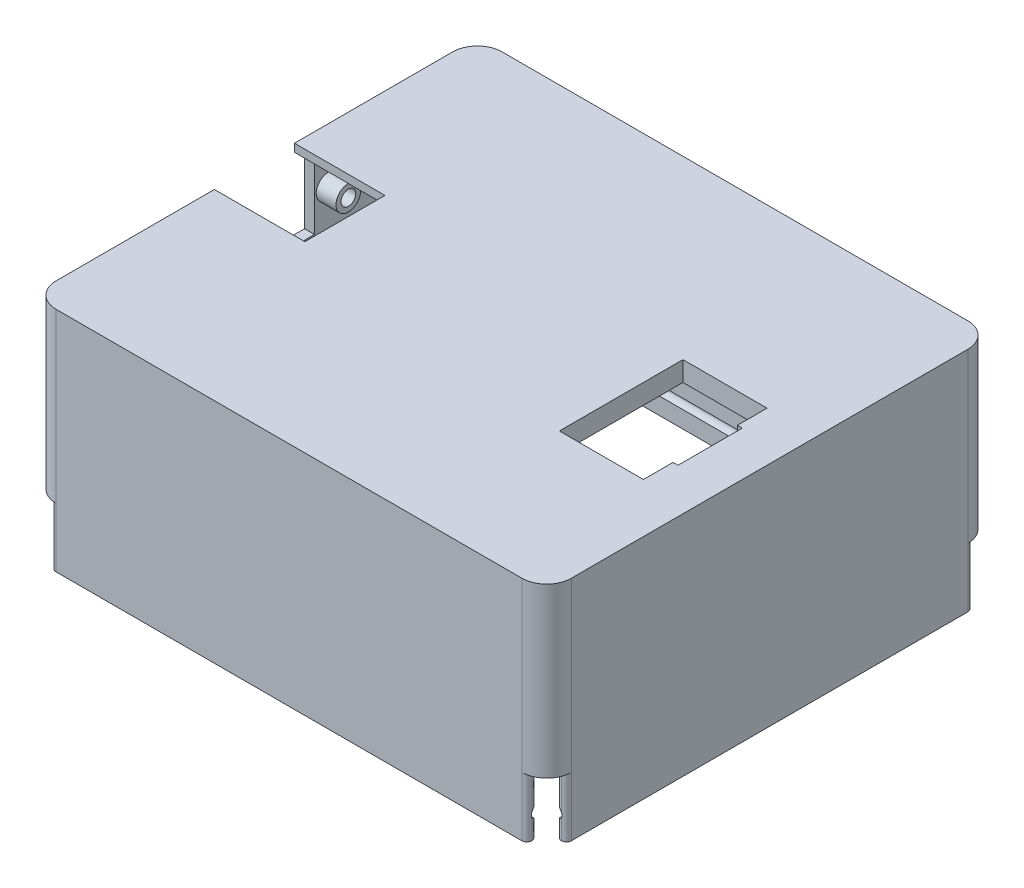
from build123d import *

# Parameters (mm, degrees)
ESQUISSE1_W                  = 104.2
ESQUISSE1_H                  = 90.2
BOSS_EXTRU_1_DEPTH           = 2
ESQUISSE2_W                  = 104.2
ESQUISSE2_H                  = 90.2
ESQUISSE2_W_2                = 100.2
ESQUISSE2_H_2                = 86.2
BOSS_EXTRU_2_DEPTH           = 44
ENL_V_MAT_EXTRU_1_DEPTH      = 12
SYM_TRIE2_COPY_1_DEPTH       = 12
CONG_3_R                     = 1
CONG_1_R                     = 5
ENL_V_MAT_EXTRU_2_DEPTH      = 82.758302331
ENL_V_MAT_EXTRU_3_DEPTH      = 82.758302438
ENL_V_MAT_EXTRU_4_DEPTH      = 122.768838535
ENL_V_MAT_EXTRU_4_DEPTH_BACK = 5
ESQUISSE6_W                  = 20.3
ESQUISSE6_H                  = 14
ESQUISSE7_W                  = 16.2
ESQUISSE7_H                  = 2
ENL_V_MAT_EXTRU_5_DEPTH      = 18.3
ESQUISSE11_W                 = 20
ESQUISSE11_H                 = 20.3
ENL_V_MAT_EXTRU_8_DEPTH      = 0.4
ESQUISSE15_W                 = 100.6
ESQUISSE15_H                 = 86.6
ENL_V_MAT_EXTRU_10_DEPTH     = 4.5
ESQUISSE16_R                 = 1.5
ENL_V_MAT_EXTRU_11_DEPTH     = 4
ENL_V_MAT_EXTRU_12_REACH     = 84.852
ESQUISSE17_W                 = 17
ESQUISSE17_H                 = 25
ESQUISSE18_W                 = 25
ESQUISSE18_H                 = 44
ESQUISSE18_W_2               = 17
ESQUISSE18_H_2               = 25
BOSS_EXTRU_3_DEPTH           = 2
ESQUISSE19_R                 = 0.85
ENL_V_MAT_EXTRU_13_DEPTH     = 2
ESQUISSE20_R                 = 2.5
ESQUISSE20_R_2               = 1.5
BOSS_EXTRU_4_DEPTH           = 4
ENL_V_MAT_EXTRU_14_REACH     = 84.852
ESQUISSE21_W                 = 1
ESQUISSE21_H                 = 13


with BuildPart() as part:
    # Esquisse1 → Boss.-Extru.1 (new body)
    with BuildSketch(Plane(origin=(0, 0, 0), x_dir=(1, 0, 0), z_dir=(0, 1, 0))):
        Rectangle(ESQUISSE1_W, ESQUISSE1_H)
    extrude(amount=BOSS_EXTRU_1_DEPTH)

    # Esquisse2 → Boss.-Extru.2 (add)
    with BuildSketch(Plane.XZ):
        Rectangle(ESQUISSE2_W, ESQUISSE2_H)
        Rectangle(ESQUISSE2_W_2, ESQUISSE2_H_2, mode=Mode.SUBTRACT)
    extrude(amount=BOSS_EXTRU_2_DEPTH)

    # Esquisse3 → Enlèv. mat.-Extru.1 (cut)
    with BuildSketch(Plane.XZ.offset(44)):
        Polygon((-50.1, 41.1), (-50.1, 43.1), (-48.1, 43.1), (-48.1, 45.1), (-52.1, 45.1), (-52.1, 41.1), align=None)
    enl_v_mat_extru_1 = extrude(amount=-ENL_V_MAT_EXTRU_1_DEPTH, mode=Mode.SUBTRACT)

    # Symétrie1: Enlèv. mat.-Extru.1 across plane
    add(enl_v_mat_extru_1.mirror(Plane.XY), mode=Mode.SUBTRACT)

    # Symétrie2: Enlèv. mat.-Extru.1 across plane
    add(enl_v_mat_extru_1.mirror(Plane(origin=(0, 0, 0), x_dir=(0, 0, 1), z_dir=(1, 0, 0))), mode=Mode.SUBTRACT)

    # Symétrie2 copy 1 sketch → Symétrie2 copy 1 (cut)
    with BuildSketch(Plane(origin=(0, -44, 0), x_dir=(-1, 0, 0), z_dir=(0, -1, 0))):
        Polygon((-50.1, 41.1), (-50.1, 43.1), (-48.1, 43.1), (-48.1, 45.1), (-52.1, 45.1), (-52.1, 41.1), align=None)
    extrude(amount=-SYM_TRIE2_COPY_1_DEPTH, mode=Mode.SUBTRACT)

    # Congé3
    cong_3_edges = [part.edges().sort_by_distance(p)[0] for p in [
        (-48.1, -38, 45.1),
        (-48.1, -38, 43.1),
        (-50.1, -38, 41.1),
        (-52.1, -38, 41.1),
        (48.1, -38, 45.1),
        (48.1, -38, 43.1),
        (52.1, -38, 41.1),
        (50.1, -38, 41.1),
        (52.1, -38, -41.1),
        (50.1, -38, -41.1),
        (48.1, -38, -43.1),
        (48.1, -38, -45.1),
        (-48.1, -38, -45.1),
        (-48.1, -38, -43.1),
        (-50.1, -38, -41.1),
        (-52.1, -38, -41.1),
    ]]
    fillet(cong_3_edges, radius=CONG_3_R - 0.0001)  # a hair under: the kernel refuses the full size

    # Congé1
    cong_1_edges = [part.edges().sort_by_distance(p)[0] for p in [
        (52.1, -15, 45.1),
        (52.1, -15, -45.1),
        (-52.1, -15, -45.1),
        (-52.1, -15, 45.1),
    ]]
    fillet(cong_1_edges, radius=CONG_1_R)

    # Esquisse4 → Enlèv. mat.-Extru.2 (cut, symmetric)
    with BuildSketch(Plane(origin=(0, 0, 0), x_dir=(0, 0, -1), z_dir=(1, 0, 0))):
        with BuildLine():
            Line((-43.1, -38.4), (-43.1, -40.6))
            ThreePointArc((-43.1, -40.6), (-44.2, -39.5), (-43.1, -38.4))
        make_face()
    enl_v_mat_extru_2 = extrude(amount=ENL_V_MAT_EXTRU_2_DEPTH, both=True, mode=Mode.SUBTRACT)

    # Symétrie4: Enlèv. mat.-Extru.2 across plane
    add(enl_v_mat_extru_2.mirror(Plane.XY), mode=Mode.SUBTRACT)

    # Esquisse5 → Enlèv. mat.-Extru.3 (cut, symmetric)
    with BuildSketch(Plane.XY):
        with BuildLine():
            Line((-50.1, -38.4), (-50.1, -40.6))
            ThreePointArc((-50.1, -40.6), (-51.2, -39.5), (-50.1, -38.4))
        make_face()
    enl_v_mat_extru_3 = extrude(amount=ENL_V_MAT_EXTRU_3_DEPTH, both=True, mode=Mode.SUBTRACT)

    # Symétrie5: Enlèv. mat.-Extru.3 across plane
    add(enl_v_mat_extru_3.mirror(Plane(origin=(0, 0, 0), x_dir=(0, 0, 1), z_dir=(1, 0, 0))), mode=Mode.SUBTRACT)

    # Esquisse6 → Enlèv. mat.-Extru.4 (cut, two sides: drawn at the far end of the back side and taken through both)
    with BuildSketch(Plane.ZY.offset(52.1).offset(-ENL_V_MAT_EXTRU_4_DEPTH_BACK)):
        with Locations((0, -7)):
            Rectangle(ESQUISSE6_W, ESQUISSE6_H)
    extrude(amount=ENL_V_MAT_EXTRU_4_DEPTH + ENL_V_MAT_EXTRU_4_DEPTH_BACK, mode=Mode.SUBTRACT)

    # Esquisse7 → Enlèv. mat.-Extru.5 (cut)
    with BuildSketch(Plane.ZY.offset(52.1)):
        with Locations((0, 1)):
            Rectangle(ESQUISSE7_W, ESQUISSE7_H)
    extrude(amount=-ENL_V_MAT_EXTRU_5_DEPTH, mode=Mode.SUBTRACT)

    # Esquisse11 → Enlèv. mat.-Extru.8 (cut)
    with BuildSketch(Plane(origin=(0, 0, 0), x_dir=(1, 0, 0), z_dir=(0, 1, 0))):
        with Locations((-42.1, 0)):
            Rectangle(ESQUISSE11_W, ESQUISSE11_H)
    extrude(amount=ENL_V_MAT_EXTRU_8_DEPTH, mode=Mode.SUBTRACT)

    # Esquisse15 → Enlèv. mat.-Extru.10 (cut)
    with BuildSketch(Plane.XZ.offset(44)):
        Rectangle(ESQUISSE15_W, ESQUISSE15_H)
    extrude(amount=-ENL_V_MAT_EXTRU_10_DEPTH, mode=Mode.SUBTRACT)

    # Esquisse16 → Enlèv. mat.-Extru.11 (cut)
    with BuildSketch(Plane.ZY.offset(52.1)):
        with Locations((-13, -7)):
            Circle(ESQUISSE16_R)
    enl_v_mat_extru_11 = extrude(amount=-ENL_V_MAT_EXTRU_11_DEPTH, mode=Mode.SUBTRACT)

    # Symétrie6: Enlèv. mat.-Extru.11 across plane
    add(enl_v_mat_extru_11.mirror(Plane.XY), mode=Mode.SUBTRACT)

    # Esquisse17 → Enlèv. mat.-Extru.12 (cut, up to next)
    with BuildSketch(Plane(origin=(0, 2, 0), x_dir=(1, 0, 0), z_dir=(0, 1, 0)), mode=Mode.PRIVATE) as enl_v_mat_extru_12_sk1:
        with Locations((33.6, -3.017922014)):
            Rectangle(ESQUISSE17_W, ESQUISSE17_H)
    enl_v_mat_extru_12_tool1 = extrude(enl_v_mat_extru_12_sk1.sketch, amount=-ENL_V_MAT_EXTRU_12_REACH, mode=Mode.PRIVATE) & part.part
    add(enl_v_mat_extru_12_tool1.solids().sort_by_distance((33.6, 2, 3.017922))[0], mode=Mode.SUBTRACT)

    # Esquisse18 → Boss.-Extru.3 (add)
    with BuildSketch(Plane.XZ):
        with Locations((33.6, -2.482077986)):
            Rectangle(ESQUISSE18_W, ESQUISSE18_H)
        with Locations((33.6, 3.017922014)):
            Rectangle(ESQUISSE18_W_2, ESQUISSE18_H_2, mode=Mode.SUBTRACT)
    extrude(amount=BOSS_EXTRU_3_DEPTH)

    # Esquisse19 → Enlèv. mat.-Extru.13 (cut)
    with BuildSketch(Plane.XZ.offset(2)):
        with Locations(Location((33.6, -21.882077986, 0), (0, 0, 270))):
            Circle(ESQUISSE19_R)
        with Locations(Location((23.6, 7.917922014, 0), (0, 0, 270))):
            Circle(ESQUISSE19_R)
        with Locations(Location((43.6, 7.917922014, 0), (0, 0, 270))):
            Circle(ESQUISSE19_R)
    extrude(amount=-ENL_V_MAT_EXTRU_13_DEPTH, mode=Mode.SUBTRACT)

    # Esquisse20 → Boss.-Extru.4 (add)
    # profile 1 of 2: a face of its own
    with BuildSketch(Plane(origin=(-50.1, 0, 0), x_dir=(0, 0, -1), z_dir=(1, 0, 0))):
        with Locations((-13, -7)):
            Circle(ESQUISSE20_R)
        with Locations((-13, -7)):
            Circle(ESQUISSE20_R_2, mode=Mode.SUBTRACT)
    # profile 2 of 2: a face of its own
    with BuildSketch(Plane(origin=(-50.1, 0, 0), x_dir=(0, 0, -1), z_dir=(1, 0, 0))):
        with Locations((13, -7)):
            Circle(ESQUISSE20_R)
        with Locations(Location((13, -7, 0), (0, 0, 180))):
            Circle(ESQUISSE20_R_2, mode=Mode.SUBTRACT)
    extrude(amount=BOSS_EXTRU_4_DEPTH)

    # Esquisse21 → Enlèv. mat.-Extru.14 (cut, up to next)
    with BuildSketch(Plane(origin=(0, 2, 0), x_dir=(1, 0, 0), z_dir=(0, 1, 0)), mode=Mode.PRIVATE) as enl_v_mat_extru_14_sk1:
        with Locations((42.6, -3.017922014)):
            Rectangle(ESQUISSE21_W, ESQUISSE21_H)
    enl_v_mat_extru_14_tool1 = extrude(enl_v_mat_extru_14_sk1.sketch, amount=-ENL_V_MAT_EXTRU_14_REACH, mode=Mode.PRIVATE) & part.part
    add(enl_v_mat_extru_14_tool1.solids().sort_by_distance((42.6, 2, 3.017922))[0], mode=Mode.SUBTRACT)


solid = part.part
